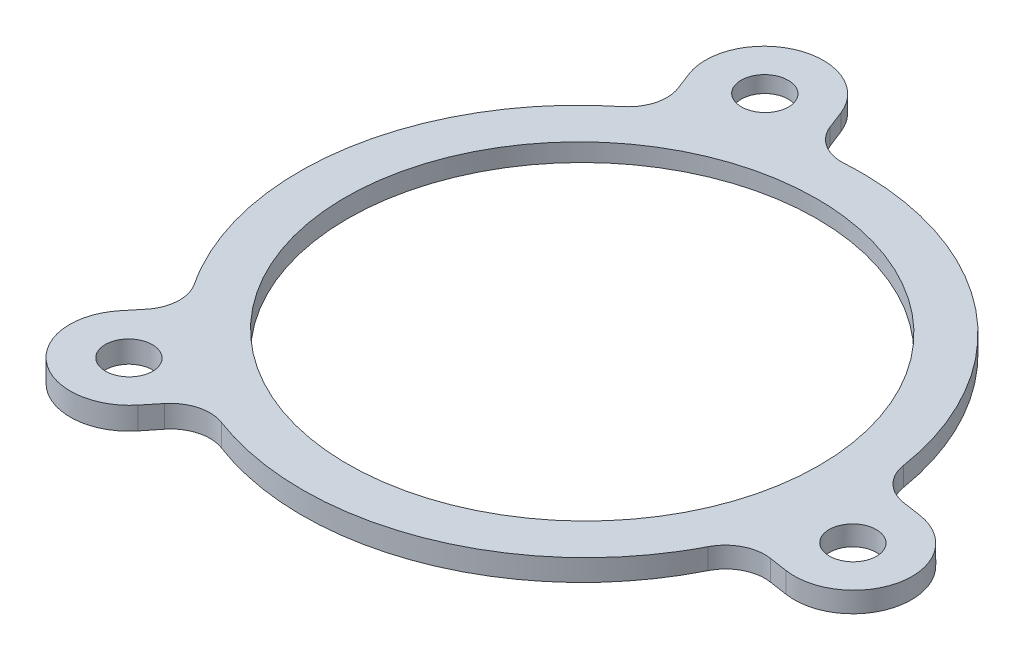
from build123d import *

# Parameters (mm, degrees)
BOSS_EXTRUDE1_REACH = 49.869
SKETCH2_R           = 12
SKETCH2_R_2         = 1.2


with BuildPart() as part:
    # Boss-Extrude1: up to this plane
    boss_extrude1_end = Plane(origin=(0, 0.999901033, -0.00994772), z_dir=(0, 0.9999505153082836, -0.009948212638360663))
    # Sketch2 → Boss-Extrude1 (new, up to the surface)
    with BuildSketch(Plane(origin=(0, 0, 0), x_dir=(1, 0, 0), z_dir=(0, 1, 0)), mode=Mode.PRIVATE) as boss_extrude1_sk1:
        with BuildLine():
            Line((-8.813634389, 14.267790609), (-8.460765596, 13.367375576))
            ThreePointArc((-8.460765596, 13.367375576), (-8.388150437, 12.130835815), (-9.05764982, 11.088687016))
            ThreePointArc((-9.05764982, 11.088687016), (-14.156836939, 2.14102029), (-11.931590899, -7.914362805))
            ThreePointArc((-11.931590899, -7.914362805), (-11.600204415, -9.107881359), (-12.035226867, -10.267648149))
            Line((-12.035226867, -10.267648149), (-12.638574763, -11.023449005))
            ThreePointArc((-12.638574763, -11.023449005), (-12.165652136, -15.239649212), (-7.949451928, -14.766726585))
            Line((-7.949451928, -14.766726585), (-7.346104032, -14.01092573))
            ThreePointArc((-7.346104032, -14.01092573), (-6.311536766, -13.329769277), (-5.074259741, -13.38849835))
            ThreePointArc((-5.074259741, -13.38849835), (5.224240508, -13.330690571), (12.819834694, -6.375879424))
            ThreePointArc((12.819834694, -6.375879424), (13.687758839, -5.492131033), (14.909657568, -5.288988132))
            Line((14.909657568, -5.288988132), (15.865874257, -5.43360231))
            ThreePointArc((15.865874257, -5.43360231), (19.28074943, -2.915939197), (16.763086318, 0.498935976))
            Line((16.763086318, 0.498935976), (15.806869628, 0.643550154))
            ThreePointArc((15.806869628, 0.643550154), (14.699687203, 1.198933462), (14.131909561, 2.299811334))
            ThreePointArc((14.131909561, 2.299811334), (8.932596431, 11.189670281), (-0.888243794, 14.290242229))
            ThreePointArc((-0.888243794, 14.290242229), (-2.087554424, 14.600012392), (-2.874430701, 15.556636282))
            Line((-2.874430701, 15.556636282), (-3.227299494, 16.457051315))
            ThreePointArc((-3.227299494, 16.457051315), (-7.115097295, 18.155588409), (-8.813634389, 14.267790609))
        make_face()
        Circle(SKETCH2_R, mode=Mode.SUBTRACT)
        with Locations((-6.020466942, 15.362420962)):
            Circle(SKETCH2_R_2, mode=Mode.SUBTRACT)
        with Locations((16.314480287, -2.467333167)):
            Circle(SKETCH2_R_2, mode=Mode.SUBTRACT)
        with Locations((-10.294013346, -12.895087795)):
            Circle(SKETCH2_R_2, mode=Mode.SUBTRACT)
    boss_extrude1_tool1 = split(extrude(boss_extrude1_sk1.sketch, amount=BOSS_EXTRUDE1_REACH, mode=Mode.PRIVATE), bisect_by=boss_extrude1_end, keep=Keep.BOTH, mode=Mode.PRIVATE)
    add(boss_extrude1_tool1.solids().sort_by_distance((-2.345651, 0, -14.19522))[0])


solid = part.part
